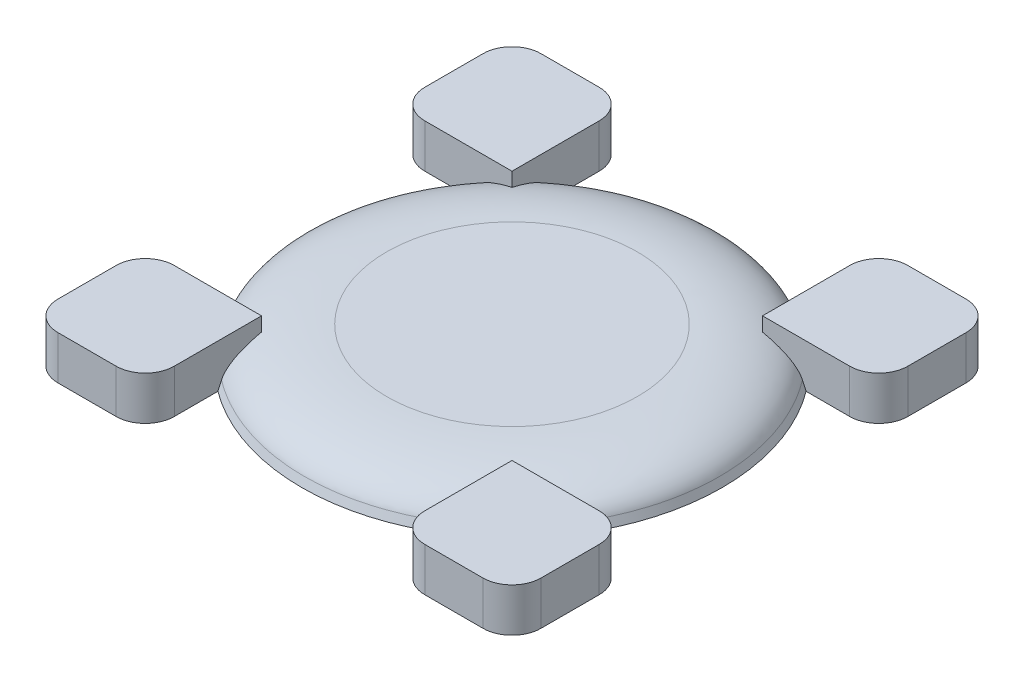
from build123d import *

# Parameters (mm, degrees)
SKETCH2_R                = 14.463803576
BOSS_EXTRUDE1_DEPTH      = 2.5
BOSS_EXTRUDE1_TAPER      = 20
SKETCH4_W                = 8
SKETCH4_H                = 8
BOSS_EXTRUDE2_DEPTH      = 3
FILLET2_R                = 2
CIRPATTERN1_COUNT        = 4
FILLET2_OF_CIRPATTERN1_R = 2


with BuildPart() as part:
    # Sketch2 → Boss-Extrude1 (new body)
    with BuildSketch(Plane(origin=(0, 0, 0), x_dir=(1, 0, 0), z_dir=(0, 1, 0))):
        Circle(SKETCH2_R)
    extrude(amount=BOSS_EXTRUDE1_DEPTH, taper=BOSS_EXTRUDE1_TAPER)

    # Fillet1
    # an asymmetric fillet: 6, 4 mm, written as the material it takes off along each edge
    with BuildSketch(Plane(origin=(0, 2.5, 0), x_dir=(1, 0, 0), z_dir=(0, 0, -1))) as fillet1_piece_1:
        with BuildLine():
            Bezier((14.262848017, 1.94787914), (13.55387799, 0), (8.624692292, 0), weights=[1, 0.819152044, 1])
            Line((8.624692292, 0), (13.55387799, 0))
            Line((13.55387799, 0), (14.262848017, 1.94787914))
        make_face()
    revolve(axis=Axis((0, 2.5, 0), (0, -1, 0)), mode=Mode.SUBTRACT)

    # Sketch4 → Boss-Extrude2 (add)
    with BuildSketch(Plane(origin=(0, 0, 0), x_dir=(1, 0, 0), z_dir=(0, 1, 0))):
        with Locations((-12.616427752, -12.616427752)):
            Rectangle(SKETCH4_W, SKETCH4_H)
    boss_extrude2 = extrude(amount=BOSS_EXTRUDE2_DEPTH)

    # Fillet2
    fillet2_edges = [part.edges().sort_by_distance(p)[0] for p in [
        (-8.616427752, 1.5, 16.616427752),
        (-16.616427752, 1.5, 8.616427752),
        (-16.616427752, 1.5, 16.616427752),
    ]]
    fillet(fillet2_edges, radius=FILLET2_R)

    # CirPattern1: Boss-Extrude2 ×4 about axis
    cirpattern1_axis = Axis((0, 0, 0), (0, 1, 0))
    for i in range(1, CIRPATTERN1_COUNT):
        add(boss_extrude2.rotate(cirpattern1_axis, i * 360 / CIRPATTERN1_COUNT))

    # Fillet2 of CirPattern1
    fillet2_of_cirpattern1_edges = [part.edges().sort_by_distance(p)[0] for p in [
        (16.616427752, 1.5, 8.616427752),
        (8.616427752, 1.5, 16.616427752),
        (16.616427752, 1.5, 16.616427752),
        (8.616427752, 1.5, -16.616427752),
        (16.616427752, 1.5, -8.616427752),
        (16.616427752, 1.5, -16.616427752),
        (-16.616427752, 1.5, -8.616427752),
        (-8.616427752, 1.5, -16.616427752),
        (-16.616427752, 1.5, -16.616427752),
    ]]
    fillet(fillet2_of_cirpattern1_edges, radius=FILLET2_OF_CIRPATTERN1_R)


solid = part.part
